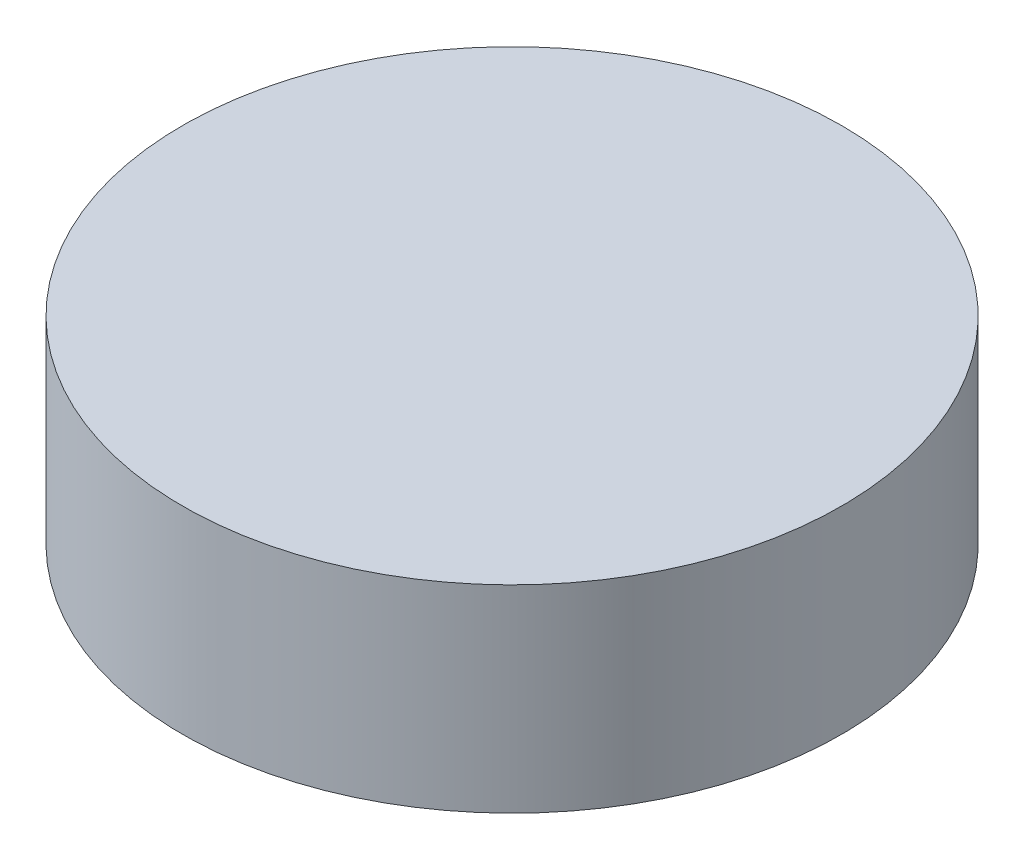
from build123d import *

# Parameters (mm, degrees)
SKETCH1_R           = 63.5
BOSS_EXTRUDE1_DEPTH = 19.05


with BuildPart() as part:
    # Sketch1 → Boss-Extrude1 (new, symmetric)
    with BuildSketch(Plane(origin=(0, 0, 0), x_dir=(1, 0, 0), z_dir=(0, 1, 0))):
        Circle(SKETCH1_R)
    extrude(amount=BOSS_EXTRUDE1_DEPTH, both=True)


solid = part.part
